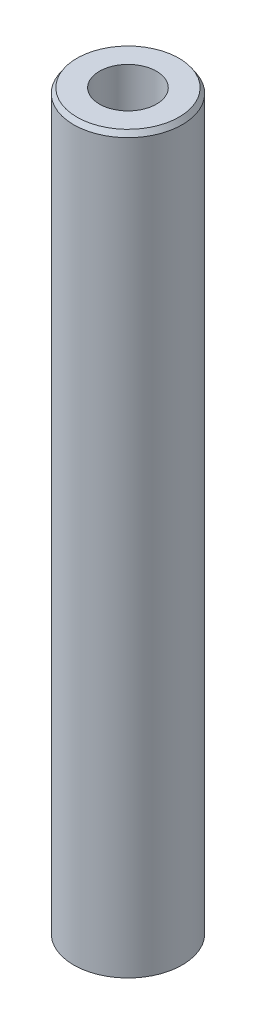
from build123d import *
from OCP.BRepFilletAPI import BRepFilletAPI_MakeChamfer

# Parameters (mm, degrees)
SKETCH1_R           = 7.5
BOSS_EXTRUDE1_DEPTH = 101.716382279
SKETCH2_R           = 3.943668837
CUT_EXTRUDE1_DEPTH  = 103.267895373
CHAMFER1_SIZE       = 0.686513349
CHAMFER1_SIZE2      = 0.446204519


with BuildPart() as part:
    # Sketch1 → Boss-Extrude1 (new body)
    with BuildSketch(Plane(origin=(0, 0, 0), x_dir=(1, 0, 0), z_dir=(0, 1, 0))):
        Circle(SKETCH1_R)
    extrude(amount=BOSS_EXTRUDE1_DEPTH)

    # Sketch2 → Cut-Extrude1 (cut, through all)
    with BuildSketch(Plane(origin=(0, 0, 0), x_dir=(1, 0, 0), z_dir=(0, 1, 0))):
        Circle(SKETCH2_R)
    extrude(amount=CUT_EXTRUDE1_DEPTH, mode=Mode.SUBTRACT)

    # Chamfer1: one chamfer whose edges measure the first distance from different faces: ONE call of the kernel's chamfer builder (chamfer() names one face for all edges)
    chamfer1_edges_1 = [part.edges().sort_by_distance(p)[0] for p in [
        (-7.5, 101.716382279, 0),
    ]]
    chamfer1_side_1 = [part.faces().sort_by_distance(p)[0] for p in [
        (-7.5, 50.85819114, 0),
    ]]
    chamfer1_edges_2 = [part.edges().sort_by_distance(p)[0] for p in [
        (-7.5, 0, 0),
    ]]
    chamfer1_side_2 = [part.faces().sort_by_distance(p)[0] for p in [
        (-7.287867966, 0, 0),
    ]]
    chamfer1 = BRepFilletAPI_MakeChamfer(part.part.solid().wrapped)
    for e in chamfer1_edges_1:
        chamfer1.Add(CHAMFER1_SIZE, CHAMFER1_SIZE2, e.wrapped, chamfer1_side_1[0].wrapped)  # the first distance lies on this face
    for e in chamfer1_edges_2:
        chamfer1.Add(CHAMFER1_SIZE, CHAMFER1_SIZE2, e.wrapped, chamfer1_side_2[0].wrapped)  # the first distance lies on this face
    add(Compound.cast(chamfer1.Shape()), mode=Mode.REPLACE)


solid = part.part
